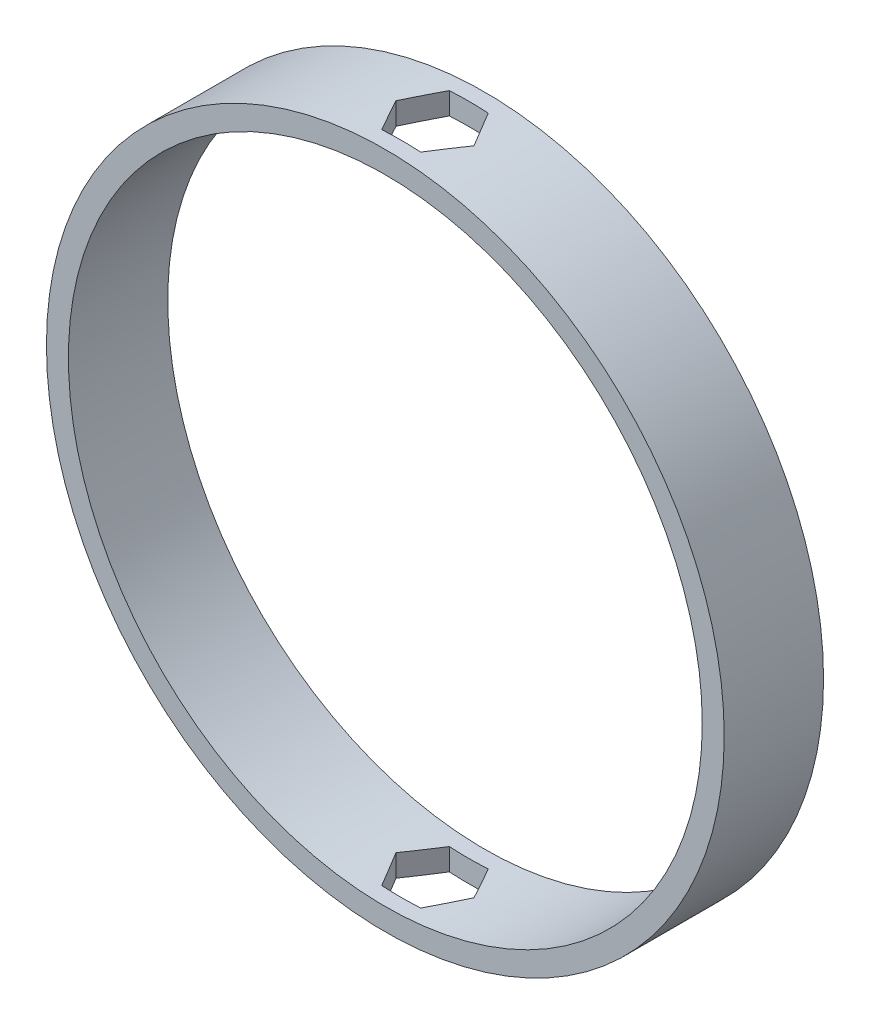
from build123d import *

# Parameters (mm, degrees)
SKETCH1_R           = 34.11
SKETCH1_R_2         = 31.9
BOSS_EXTRUDE1_DEPTH = 10
CUT_EXTRUDE1_DEPTH  = 77.925031687


with BuildPart() as part:
    # Sketch1 → Boss-Extrude1 (new body)
    with BuildSketch(Plane.XY):
        Circle(SKETCH1_R)
        Circle(SKETCH1_R_2, mode=Mode.SUBTRACT)
    extrude(amount=BOSS_EXTRUDE1_DEPTH)

    # Sketch2 → Cut-Extrude1 (cut, through all)
    with BuildSketch(Plane(origin=(0, 34.11, 0), x_dir=(1, 0, 0), z_dir=(0, 1, 0))):
        Polygon((3.92598183, -5), (1.962990915, -1.6), (-1.962990915, -1.6), (-3.92598183, -5), (-1.962990915, -8.4), (1.962990915, -8.4), align=None)
    extrude(amount=-CUT_EXTRUDE1_DEPTH, mode=Mode.SUBTRACT)


solid = part.part
